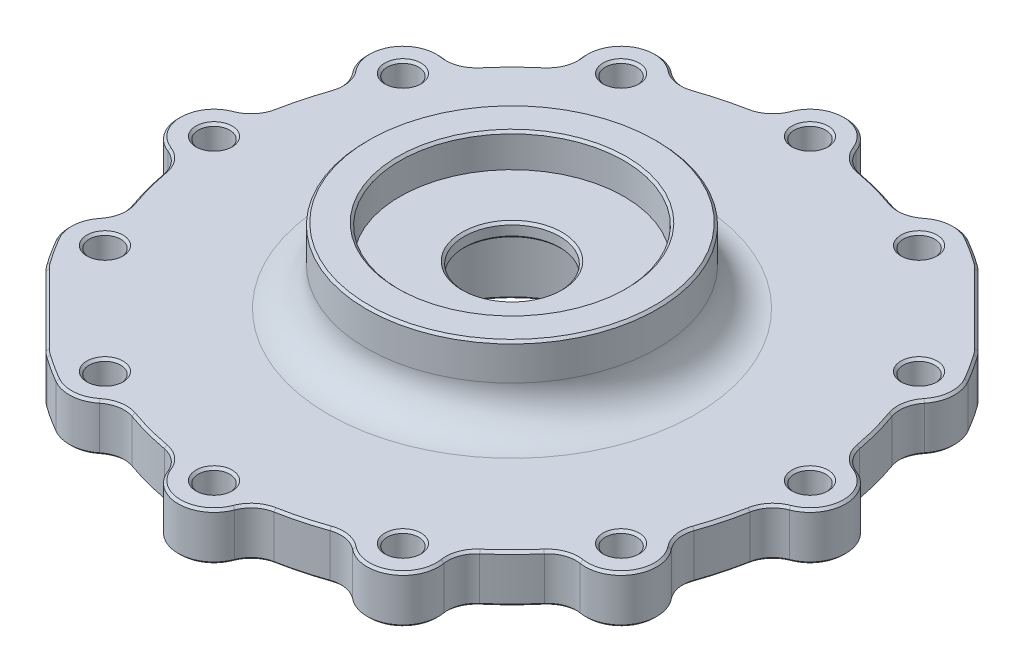
from build123d import *

# Parameters (mm, degrees)
M6_CLEARANCE_HOLE1_D = 6.6
M6_CLEARANCE_HOLE2_D = 6.6
CUT_EXTRUDE1_DEPTH   = 101.216565497
CHAMFER1_SIZE        = 0.5


with BuildPart() as part:
    # Sketch1 → Revolve1 (revolve)
    with BuildSketch(Plane.XY):
        with BuildLine():
            Line((-70, -16.698290186), (-70, -26.698290186))
            Line((-70, -26.698290186), (-45, -26.698290186))
            Line((-45, -26.698290186), (-45, -31.698290186))
            Line((-45, -31.698290186), (-23.5, -31.698290186))
            Line((-23.5, -31.698290186), (-23.5, -11.098290186))
            Line((-23.5, -11.098290186), (-10, -11.098290186))
            Line((-10, -11.098290186), (-10, -8.098290186))
            Line((-10, -8.098290186), (-23.5, -8.098290186))
            Line((-23.5, -8.098290186), (-23.5, -1.098290186))
            Line((-23.5, -1.098290186), (-30.5, -1.098290186))
            Line((-30.5, -1.098290186), (-30.5, -8.698290186))
            ThreePointArc((-30.5, -8.698290186), (-32.843145751, -14.355144435), (-38.5, -16.698290186))
            Line((-38.5, -16.698290186), (-70, -16.698290186))
        make_face()
    revolve(axis=Axis((0, 95.786399453, 0), (0, -1, 0)))

    # M6 Clearance Hole1 (through all)
    with Locations(Plane(origin=(0, -16.698290186, 0), x_dir=(1, 0, 0), z_dir=(0, 1, 0))):
        with Locations((-31.25, 54.126587737), (0, 62.5), (31.25, 54.126587737), (54.126587737, 31.25), (62.5, 0), (54.126587737, -31.25), (31.25, -54.126587737), (0, -62.5), (-31.25, -54.126587737), (-54.126587737, -31.25), (-62.5, 0), (-54.126587737, 31.25)):
            Hole(M6_CLEARANCE_HOLE1_D / 2)

    # M6 Clearance Hole2 (through all)
    with Locations(Plane(origin=(0, -16.698290186, 0), x_dir=(1, 0, 0), z_dir=(0, 1, 0))):
        with Locations((0, 0), (31.25, -54.126587737), (0, -62.5), (-31.25, -54.126587737), (-54.126587737, -31.25), (-62.5, 0), (-54.126587737, 31.25), (-31.25, 54.126587737), (0, 62.5), (31.25, 54.126587737), (54.126587737, 31.25), (62.5, 0), (54.126587737, -31.25)):
            Hole(M6_CLEARANCE_HOLE2_D / 2)

    # Sketch6 → Cut-Extrude1 (cut, through all)
    with BuildSketch(Plane(origin=(0, -16.698290186, 0), x_dir=(1, 0, 0), z_dir=(0, 1, 0))):
        with BuildLine():
            ThreePointArc((-7.003550687, 65.183333333), (-4.249999994, 68.679603551), (1.5e-08, 70))
            ThreePointArc((1.5e-08, 70), (-18.117332822, 67.61480793), (-34.999999412, 60.621778604))
            ThreePointArc((-34.999999412, 60.621778604), (-30.659193469, 61.603281367), (-26.526413855, 59.952197913))
            ThreePointArc((-26.526413855, 59.952197913), (-23.770921754, 58.700605212), (-20.755059251, 58.953180707))
            ThreePointArc((-20.755059251, 58.953180707), (-16.176190319, 60.370364143), (-11.502181785, 61.432481752))
            ThreePointArc((-11.502181785, 61.432481752), (-8.764080496, 62.721676208), (-7.003550687, 65.183333333))
        make_face()
        with BuildLine():
            ThreePointArc((26.526413855, 59.952197913), (30.659193807, 61.603281394), (35, 60.621778265))
            ThreePointArc((35, 60.621778265), (18.117333164, 67.614807838), (1.5e-08, 70))
            ThreePointArc((1.5e-08, 70), (4.250000006, 68.679603543), (7.003550687, 65.183333333))
            ThreePointArc((7.003550687, 65.183333333), (8.764080496, 62.721676208), (11.502181785, 61.432481752))
            ThreePointArc((11.502181785, 61.432481752), (16.176190319, 60.370364143), (20.755059251, 58.953180707))
            ThreePointArc((20.755059251, 58.953180707), (23.770921754, 58.700605212), (26.526413855, 59.952197913))
        make_face()
        with BuildLine():
            ThreePointArc((-38.656919478, 52.948647227), (-38.020409594, 57.3532817), (-34.999999412, 60.621778604))
            ThreePointArc((-34.999999412, 60.621778604), (-49.497474345, 49.497475021), (-60.621778126, 35.000000241))
            ThreePointArc((-60.621778126, 35.000000241), (-57.353281268, 38.0204098), (-52.948647227, 38.656919478))
            ThreePointArc((-52.948647227, 38.656919478), (-49.936524716, 38.950754454), (-47.450998922, 40.677422501))
            ThreePointArc((-47.450998922, 40.677422501), (-44.194173824, 44.194173824), (-40.677422501, 47.450998922))
            ThreePointArc((-40.677422501, 47.450998922), (-38.950754454, 49.936524716), (-38.656919478, 52.948647227))
        make_face()
        with BuildLine():
            ThreePointArc((-59.952197913, 26.526413855), (-61.603281405, 30.659193946), (-60.621778126, 35.000000241))
            ThreePointArc((-60.621778126, 35.000000241), (-67.614807771, 18.117333416), (-70, 2.57e-07))
            ThreePointArc((-70, 2.57e-07), (-68.679603474, 4.250000106), (-65.183333333, 7.003550687))
            ThreePointArc((-65.183333333, 7.003550687), (-62.721676208, 8.764080496), (-61.432481752, 11.502181785))
            ThreePointArc((-61.432481752, 11.502181785), (-60.370364143, 16.176190319), (-58.953180707, 20.755059251))
            ThreePointArc((-58.953180707, 20.755059251), (-58.700605212, 23.770921754), (-59.952197913, 26.526413855))
        make_face()
        with BuildLine():
            ThreePointArc((-65.183333333, -7.003550687), (-68.67960362, -4.249999894), (-70, 2.57e-07))
            ThreePointArc((-70, 2.57e-07), (-67.614807873, -18.117333033), (-60.621778265, -35))
            ThreePointArc((-60.621778265, -35), (-61.603281394, -30.659193807), (-59.952197913, -26.526413855))
            ThreePointArc((-59.952197913, -26.526413855), (-58.700605212, -23.770921754), (-58.953180707, -20.755059251))
            ThreePointArc((-58.953180707, -20.755059251), (-60.370364143, -16.176190319), (-61.432481752, -11.502181785))
            ThreePointArc((-61.432481752, -11.502181785), (-62.721676208, -8.764080496), (-65.183333333, -7.003550687))
        make_face()
        with BuildLine():
            ThreePointArc((-35, -60.621778265), (-18.117333226, -67.614807822), (-1.43e-07, -70))
            ThreePointArc((-1.43e-07, -70), (-4.250000059, -68.679603507), (-7.003550687, -65.183333333))
            ThreePointArc((-7.003550687, -65.183333333), (-8.764080496, -62.721676208), (-11.502181785, -61.432481752))
            ThreePointArc((-11.502181785, -61.432481752), (-16.176190319, -60.370364143), (-20.755059251, -58.953180707))
            ThreePointArc((-20.755059251, -58.953180707), (-23.770921754, -58.700605212), (-26.526413855, -59.952197913))
            ThreePointArc((-26.526413855, -59.952197913), (-30.659193807, -61.603281394), (-35, -60.621778265))
        make_face()
        with BuildLine():
            ThreePointArc((-1.43e-07, -70), (18.117333048, -67.61480787), (34.999999928, -60.621778307))
            ThreePointArc((34.999999928, -60.621778307), (30.659193766, -61.60328139), (26.526413855, -59.952197913))
            ThreePointArc((26.526413855, -59.952197913), (23.770921754, -58.700605212), (20.755059251, -58.953180707))
            ThreePointArc((20.755059251, -58.953180707), (16.176190319, -60.370364143), (11.502181785, -61.432481752))
            ThreePointArc((11.502181785, -61.432481752), (8.764080496, -62.721676208), (7.003550687, -65.183333333))
            ThreePointArc((7.003550687, -65.183333333), (4.249999941, -68.679603588), (-1.43e-07, -70))
        make_face()
        with BuildLine():
            ThreePointArc((34.999999928, -60.621778307), (49.497474453, -49.497474913), (60.621777982, -35.00000049))
            ThreePointArc((60.621777982, -35.00000049), (57.353281138, -38.020409861), (52.948647227, -38.656919478))
            ThreePointArc((52.948647227, -38.656919478), (49.936524716, -38.950754454), (47.450998922, -40.677422501))
            ThreePointArc((47.450998922, -40.677422501), (44.194173824, -44.194173824), (40.677422501, -47.450998922))
            ThreePointArc((40.677422501, -47.450998922), (38.950754454, -49.936524716), (38.656919478, -52.948647227))
            ThreePointArc((38.656919478, -52.948647227), (38.020409722, -57.353281431), (34.999999928, -60.621778307))
        make_face()
        with BuildLine():
            ThreePointArc((60.621777982, -35.00000049), (67.614807767, -18.117333431), (70, 0))
            ThreePointArc((70, 0), (68.679603547, -4.25), (65.183333333, -7.003550687))
            ThreePointArc((65.183333333, -7.003550687), (62.721676208, -8.764080496), (61.432481752, -11.502181785))
            ThreePointArc((61.432481752, -11.502181785), (60.370364143, -16.176190319), (58.953180707, -20.755059251))
            ThreePointArc((58.953180707, -20.755059251), (58.700605212, -23.770921754), (59.952197913, -26.526413855))
            ThreePointArc((59.952197913, -26.526413855), (61.603281416, -30.65919409), (60.621777982, -35.00000049))
        make_face()
        with BuildLine():
            ThreePointArc((70, 0), (67.61480784, 18.117333157), (60.621778265, 35))
            ThreePointArc((60.621778265, 35), (61.603281394, 30.659193807), (59.952197913, 26.526413855))
            ThreePointArc((59.952197913, 26.526413855), (58.700605212, 23.770921754), (58.953180707, 20.755059251))
            ThreePointArc((58.953180707, 20.755059251), (60.370364143, 16.176190319), (61.432481752, 11.502181785))
            ThreePointArc((61.432481752, 11.502181785), (62.721676208, 8.764080496), (65.183333333, 7.003550687))
            ThreePointArc((65.183333333, 7.003550687), (68.679603547, 4.25), (70, 0))
        make_face()
        with BuildLine():
            ThreePointArc((-57.238204351, -40.296252465), (-49.497474683, -49.497474683), (-40.296252465, -57.238204351))
            ThreePointArc((-40.296252465, -57.238204351), (-40.977270471, -56.713571141), (-41.610712782, -56.132385827))
            Line((-41.610712782, -56.132385827), (-56.132385827, -41.610712782))
            ThreePointArc((-56.132385827, -41.610712782), (-56.713571141, -40.977270471), (-57.238204351, -40.296252465))
        make_face()
        with BuildLine():
            Line((41.610712782, 56.132385827), (56.132385827, 41.610712782))
            ThreePointArc((56.132385827, 41.610712782), (56.713571141, 40.977270471), (57.238204351, 40.296252465))
            ThreePointArc((57.238204351, 40.296252465), (49.497474683, 49.497474683), (40.296252465, 57.238204351))
            ThreePointArc((40.296252465, 57.238204351), (40.977270471, 56.713571141), (41.610712782, 56.132385827))
        make_face()
    extrude(amount=-CUT_EXTRUDE1_DEPTH, mode=Mode.SUBTRACT)

    # Chamfer1
    chamfer1_edges = [part.edges().sort_by_distance(p)[0] for p in [
        (-27.95, -16.698290186, -54.126587737),
        (-50.826587737, -16.698290186, -31.25),
        (-59.2, -16.698290186, 0),
        (-50.826587737, -16.698290186, 31.25),
        (-27.95, -16.698290186, 54.126587737),
        (3.3, -16.698290186, 62.5),
        (34.55, -16.698290186, 54.126587737),
        (57.426587737, -16.698290186, 31.25),
        (65.8, -16.698290186, 0),
        (57.426587737, -16.698290186, -31.25),
        (34.55, -16.698290186, -54.126587737),
        (3.3, -16.698290186, -62.5),
        (-30.659193807, -16.698290186, 61.603281394),
        (-23.770921754, -16.698290186, 58.700605212),
        (-16.176190319, -16.698290186, 60.370364143),
        (-8.764080496, -16.698290186, 62.721676208),
        (0, -16.698290186, 70),
        (58.700605212, -16.698290186, -23.770921754),
        (60.370364143, -16.698290186, -16.176190319),
        (62.721676208, -16.698290186, -8.764080496),
        (70, -16.698290186, 0),
        (62.721676208, -16.698290186, 8.764080496),
        (60.370364143, -16.698290186, 16.176190319),
        (58.700605212, -16.698290186, 23.770921754),
        (60.621778265, -16.698290186, 35),
        (49.936524716, -16.698290186, 38.950754454),
        (44.194173824, -16.698290186, 44.194173824),
        (38.950754454, -16.698290186, 49.936524716),
        (35, -16.698290186, 60.621778265),
        (23.770921754, -16.698290186, 58.700605212),
        (16.176190319, -16.698290186, 60.370364143),
        (8.764080496, -16.698290186, 62.721676208),
        (-37.686118823, -16.698290186, 58.989460483),
        (-40.977270471, -16.698290186, 56.713571141),
        (-48.871549304, -16.698290186, 48.871549304),
        (-56.713571141, -16.698290186, 40.977270471),
        (-58.989460483, -16.698290186, 37.686118823),
        (-61.603281394, -16.698290186, 30.659193807),
        (-58.700605212, -16.698290186, 23.770921754),
        (-60.370364143, -16.698290186, 16.176190319),
        (-62.721676208, -16.698290186, 8.764080496),
        (-70, -16.698290186, 0),
        (-62.721676208, -16.698290186, -8.764080496),
        (-60.370364143, -16.698290186, -16.176190319),
        (-58.700605212, -16.698290186, -23.770921754),
        (-60.621778265, -16.698290186, -35),
        (-49.936524716, -16.698290186, -38.950754454),
        (-44.194173824, -16.698290186, -44.194173824),
        (-38.950754454, -16.698290186, -49.936524716),
        (-35, -16.698290186, -60.621778265),
        (-23.770921754, -16.698290186, -58.700605212),
        (-16.176190319, -16.698290186, -60.370364143),
        (-8.764080496, -16.698290186, -62.721676208),
        (0, -16.698290186, -70),
        (8.764080496, -16.698290186, -62.721676208),
        (16.176190319, -16.698290186, -60.370364143),
        (23.770921754, -16.698290186, -58.700605212),
        (30.659193807, -16.698290186, -61.603281394),
        (37.686118823, -16.698290186, -58.989460483),
        (40.977270471, -16.698290186, -56.713571141),
        (48.871549304, -16.698290186, -48.871549304),
        (56.713571141, -16.698290186, -40.977270471),
        (58.989460483, -16.698290186, -37.686118823),
        (61.603281394, -16.698290186, -30.659193807),
        (45, -31.698290186, 0),
        (23.5, -31.698290186, 0),
        (10, -8.098290186, 0),
        (10, -11.098290186, 0),
        (30.5, -1.098290186, 0),
        (23.5, -1.098290186, 0),
        (56.713571141, -26.698290186, -40.977270471),
        (48.871549304, -26.698290186, -48.871549304),
        (40.977270471, -26.698290186, -56.713571141),
        (37.686118823, -26.698290186, -58.989460483),
        (30.659193807, -26.698290186, -61.603281394),
        (23.770921754, -26.698290186, -58.700605212),
        (16.176190319, -26.698290186, -60.370364143),
        (8.764080496, -26.698290186, -62.721676208),
        (0, -26.698290186, -70),
        (-8.764080496, -26.698290186, -62.721676208),
        (-16.176190319, -26.698290186, -60.370364143),
        (-23.770921754, -26.698290186, -58.700605212),
        (-35, -26.698290186, -60.621778265),
        (-38.950754454, -26.698290186, -49.936524716),
        (-44.194173824, -26.698290186, -44.194173824),
        (-49.936524716, -26.698290186, -38.950754454),
        (-60.621778265, -26.698290186, -35),
        (-58.700605212, -26.698290186, -23.770921754),
        (-60.370364143, -26.698290186, -16.176190319),
        (-62.721676208, -26.698290186, -8.764080496),
        (-70, -26.698290186, 0),
        (-62.721676208, -26.698290186, 8.764080496),
        (-60.370364143, -26.698290186, 16.176190319),
        (-58.700605212, -26.698290186, 23.770921754),
        (-61.603281394, -26.698290186, 30.659193807),
        (-58.989460483, -26.698290186, 37.686118823),
        (-56.713571141, -26.698290186, 40.977270471),
        (-48.871549304, -26.698290186, 48.871549304),
        (-40.977270471, -26.698290186, 56.713571141),
        (-37.686118823, -26.698290186, 58.989460483),
        (-30.659193807, -26.698290186, 61.603281394),
        (-23.770921754, -26.698290186, 58.700605212),
        (-16.176190319, -26.698290186, 60.370364143),
        (-8.764080496, -26.698290186, 62.721676208),
        (0, -26.698290186, 70),
        (8.764080496, -26.698290186, 62.721676208),
        (16.176190319, -26.698290186, 60.370364143),
        (23.770921754, -26.698290186, 58.700605212),
        (35, -26.698290186, 60.621778265),
        (38.950754454, -26.698290186, 49.936524716),
        (44.194173824, -26.698290186, 44.194173824),
        (49.936524716, -26.698290186, 38.950754454),
        (60.621778265, -26.698290186, 35),
        (58.700605212, -26.698290186, 23.770921754),
        (60.370364143, -26.698290186, 16.176190319),
        (62.721676208, -26.698290186, 8.764080496),
        (70, -26.698290186, 0),
        (62.721676208, -26.698290186, -8.764080496),
        (60.370364143, -26.698290186, -16.176190319),
        (58.700605212, -26.698290186, -23.770921754),
        (61.603281394, -26.698290186, -30.659193807),
        (58.989460483, -26.698290186, -37.686118823),
        (45, -26.698290186, 0),
        (-27.95, -26.698290186, -54.126587737),
        (-50.826587737, -26.698290186, -31.25),
        (-59.2, -26.698290186, 0),
        (-50.826587737, -26.698290186, 31.25),
        (-27.95, -26.698290186, 54.126587737),
        (3.3, -26.698290186, 62.5),
        (34.55, -26.698290186, 54.126587737),
        (57.426587737, -26.698290186, 31.25),
        (65.8, -26.698290186, 0),
        (57.426587737, -26.698290186, -31.25),
        (34.55, -26.698290186, -54.126587737),
        (3.3, -26.698290186, -62.5),
    ]]
    chamfer(chamfer1_edges, length=CHAMFER1_SIZE)


solid = part.part
